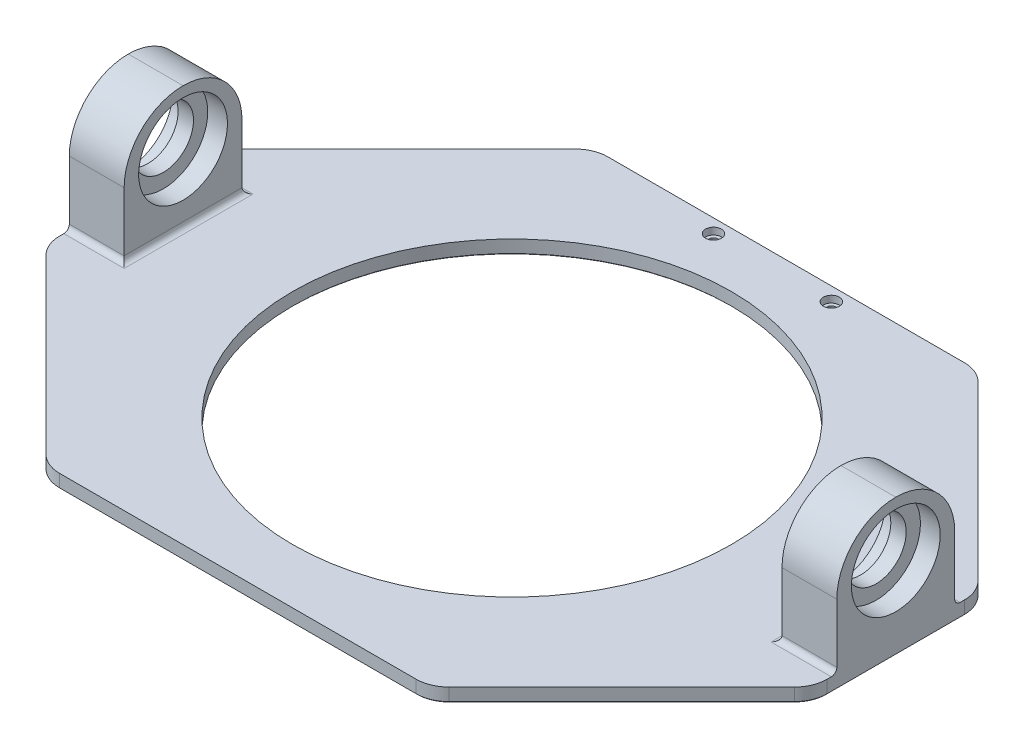
from build123d import *

# Parameters (mm, degrees)
SKETCH_1_W           = 280
SKETCH_1_H           = 280
EXTRUDE_1_DEPTH      = 5
SKETCH_2_R           = 80
CUT_EXTRUDE_1_DEPTH  = 5
SKETCH_3_W           = 20
SKETCH_3_H           = 43
EXTRUDE_2_DEPTH      = 45
SKETCH_4_R           = 11
CUT_EXTRUDE_2_DEPTH  = 400.12404087
SKETCH_5_R           = 16.2
CUT_EXTRUDE_3_DEPTH  = 7.2
CUT_EXTRUDE_START    = -7.2
SKETCH_6_R           = 16.2
CUT_EXTRUDE_4_DEPTH  = 7.2
SKETCH_7_R           = 16.2
CUT_EXTRUDE_5_DEPTH  = 7.2
SKETCH_8_R           = 16.2
CUT_EXTRUDE_6_DEPTH  = 7.2
SKETCH_9_W           = 280
SKETCH_9_H           = 80
CUT_EXTRUDE_7_DEPTH  = 399.52854352
CHAMFER_1_SIZE       = 70
FILLET_1_R           = 21.5
FILLET_2_R           = 12
FILLET_3_R           = 2
SKETCH_10_R          = 1.6
CUT_EXTRUDE_8_DEPTH  = 5
SKETCH_11_R          = 2.35
CUT_EXTRUDE_9_DEPTH  = 4.2
CHAMFER_4_SIZE       = 0.4
SKETCH_12_R          = 1.65
CUT_EXTRUDE_10_DEPTH = 10
SKETCH_13_R          = 2.9
CUT_EXTRUDE_11_DEPTH = 2.5


with BuildPart() as part:
    # 草图1 → 凸台-拉伸1 (new body)
    with BuildSketch(Plane(origin=(0, 0, 0), x_dir=(1, 0, 0), z_dir=(0, 1, 0))):
        with Locations((140, -140)):
            Rectangle(SKETCH_1_W, SKETCH_1_H)
    extrude(amount=EXTRUDE_1_DEPTH)

    # 草图2 → 切除-拉伸1 (cut)
    with BuildSketch(Plane(origin=(0, 5, 0), x_dir=(1, 0, 0), z_dir=(0, 1, 0))):
        with Locations(Location((140, -180, 0), (0, 0, 270))):
            Circle(SKETCH_2_R)
    extrude(amount=-CUT_EXTRUDE_1_DEPTH, mode=Mode.SUBTRACT)

    # 草图3 → 凸台-拉伸2 (add)
    with BuildSketch(Plane(origin=(0, 5, 0), x_dir=(1, 0, 0), z_dir=(0, 1, 0))):
        with Locations((10, -180)):
            Rectangle(SKETCH_3_W, SKETCH_3_H)
        with Locations((270, -180)):
            Rectangle(SKETCH_3_W, SKETCH_3_H)
    extrude(amount=EXTRUDE_2_DEPTH)

    # 草图4 → 切除-拉伸2 (cut, through all)
    with BuildSketch(Plane(origin=(280, 0, 0), x_dir=(0, 0, -1), z_dir=(1, 0, 0))):
        with Locations((-180, 30)):
            Circle(SKETCH_4_R)
    extrude(amount=-CUT_EXTRUDE_2_DEPTH, mode=Mode.SUBTRACT)

    # 草图5 → 切除-拉伸3 (cut)
    with BuildSketch(Plane(origin=(280, 0, 0), x_dir=(0, 0, -1), z_dir=(1, 0, 0))):
        with Locations((-180, 30)):
            Circle(SKETCH_5_R)
    extrude(amount=-CUT_EXTRUDE_3_DEPTH, mode=Mode.SUBTRACT)

    # 草图6 → 切除-拉伸4 (cut)
    with BuildSketch(Plane.ZY.offset(-260).offset(CUT_EXTRUDE_START)):
        with Locations(Location((180, 30, 0), (0, 0, 180))):
            Circle(SKETCH_6_R)
    extrude(amount=CUT_EXTRUDE_4_DEPTH, mode=Mode.SUBTRACT)

    # 草图7 → 切除-拉伸5 (cut)
    with BuildSketch(Plane(origin=(20, 0, 0), x_dir=(0, 0, -1), z_dir=(1, 0, 0))):
        with Locations((-180, 30)):
            Circle(SKETCH_7_R)
    extrude(amount=-CUT_EXTRUDE_5_DEPTH, mode=Mode.SUBTRACT)

    # 草图8 → 切除-拉伸6 (cut)
    with BuildSketch(Plane.ZY.offset(CUT_EXTRUDE_START)):
        with Locations(Location((180, 30, 0), (0, 0, 180))):
            Circle(SKETCH_8_R)
    extrude(amount=CUT_EXTRUDE_6_DEPTH, mode=Mode.SUBTRACT)

    # 草图9 → 切除-拉伸7 (cut, through all)
    with BuildSketch(Plane(origin=(0, 5, 0), x_dir=(1, 0, 0), z_dir=(0, 1, 0))):
        with Locations((140, -40)):
            Rectangle(SKETCH_9_W, SKETCH_9_H)
    extrude(amount=-CUT_EXTRUDE_7_DEPTH, mode=Mode.SUBTRACT)

    # 倒角1
    chamfer_1_edges = [part.edges().sort_by_distance(p)[0] for p in [
        (280, 2.5, 280),
        (0, 2.5, 280),
        (0, 2.5, 80),
        (280, 2.5, 80),
    ]]
    chamfer(chamfer_1_edges, length=CHAMFER_1_SIZE)

    # 圆角1
    fillet_1_edges = [part.edges().sort_by_distance(p)[0] for p in [
        (270, 50, 201.5),
        (270, 50, 158.5),
        (10, 50, 201.5),
        (10, 50, 158.5),
    ]]
    fillet(fillet_1_edges, radius=FILLET_1_R - 0.0001)  # a hair under: the kernel refuses the full size

    # 圆角2
    fillet_2_edges = [part.edges().sort_by_distance(p)[0] for p in [
        (280, 2.5, 210),
        (280, 2.5, 150),
        (70, 2.5, 80),
        (210, 2.5, 80),
        (70, 2.5, 280),
        (210, 2.5, 280),
        (0, 2.5, 150),
        (0, 2.5, 210),
    ]]
    fillet(fillet_2_edges, radius=FILLET_2_R)

    # 圆角3
    fillet_3_edges = [part.edges().sort_by_distance(p)[0] for p in [
        (10, 5, 201.5),
        (20, 5, 180),
        (10, 5, 158.5),
        (270, 5, 158.5),
        (260, 5, 180),
        (270, 5, 201.5),
    ]]
    fillet(fillet_3_edges, radius=FILLET_3_R)

    # 草图10 → 切除-拉伸8 (cut)
    with BuildSketch(Plane(origin=(0, 0, 0), x_dir=(-1, 0, 0), z_dir=(0, -1, 0))):
        with Locations(Location((-20, -187.5, 0), (0, 0, 90))):
            Circle(SKETCH_10_R)
        with Locations(Location((-20, -172.5, 0), (0, 0, 90))):
            Circle(SKETCH_10_R)
        with Locations(Location((-260, -187.5, 0), (0, 0, 270))):
            Circle(SKETCH_10_R)
        with Locations(Location((-260, -172.5, 0), (0, 0, 270))):
            Circle(SKETCH_10_R)
    extrude(amount=-CUT_EXTRUDE_8_DEPTH, mode=Mode.SUBTRACT)

    # 草图11 → 切除-拉伸9 (cut)
    with BuildSketch(Plane(origin=(0, 0, 0), x_dir=(-1, 0, 0), z_dir=(0, -1, 0))):
        with Locations(Location((-20, -172.5, 0), (0, 0, 90))):
            Circle(SKETCH_11_R)
        with Locations(Location((-20, -187.5, 0), (0, 0, 90))):
            Circle(SKETCH_11_R)
        with Locations(Location((-260, -172.5, 0), (0, 0, 90))):
            Circle(SKETCH_11_R)
        with Locations(Location((-260, -187.5, 0), (0, 0, 90))):
            Circle(SKETCH_11_R)
    extrude(amount=-CUT_EXTRUDE_9_DEPTH, mode=Mode.SUBTRACT)

    # 倒角4
    chamfer_4_edges = [part.edges().sort_by_distance(p)[0] for p in [
        (140, 0, 80),
        (140, 0, 100),
        (35, 0, 115),
        (245, 0, 115),
        (280, 0, 180),
        (245, 0, 245),
        (140, 0, 280),
        (35, 0, 245),
        (0, 0, 180),
        (0.91344561, 0, 150.37836156),
        (0.91344561, 0, 209.62163844),
        (70.37836156, 0, 279.08655439),
        (209.62163844, 0, 279.08655439),
        (279.08655439, 0, 209.62163844),
        (279.08655439, 0, 150.37836156),
        (209.62163844, 0, 80.91344561),
        (70.37836156, 0, 80.91344561),
        (20, 0, 189.85),
        (260, 0, 174.85),
        (260, 0, 189.85),
        (20, 0, 174.85),
    ]]
    chamfer(chamfer_4_edges, length=CHAMFER_4_SIZE)

    # 草图12 → 切除-拉伸10 (cut)
    with BuildSketch(Plane(origin=(0, 5, 0), x_dir=(1, 0, 0), z_dir=(0, 1, 0))):
        with Locations(Location((118.5, -85, 0), (0, 0, 270))):
            Circle(SKETCH_12_R)
        with Locations(Location((161.5, -85, 0), (0, 0, 270))):
            Circle(SKETCH_12_R)
    extrude(amount=-CUT_EXTRUDE_10_DEPTH, mode=Mode.SUBTRACT)

    # 草图13 → 切除-拉伸11 (cut)
    with BuildSketch(Plane(origin=(0, 5, 0), x_dir=(1, 0, 0), z_dir=(0, 1, 0))):
        with Locations(Location((118.5, -85, 0), (0, 0, 270))):
            Circle(SKETCH_13_R)
        with Locations(Location((161.5, -85, 0), (0, 0, 270))):
            Circle(SKETCH_13_R)
    extrude(amount=-CUT_EXTRUDE_11_DEPTH, mode=Mode.SUBTRACT)


solid = part.part
